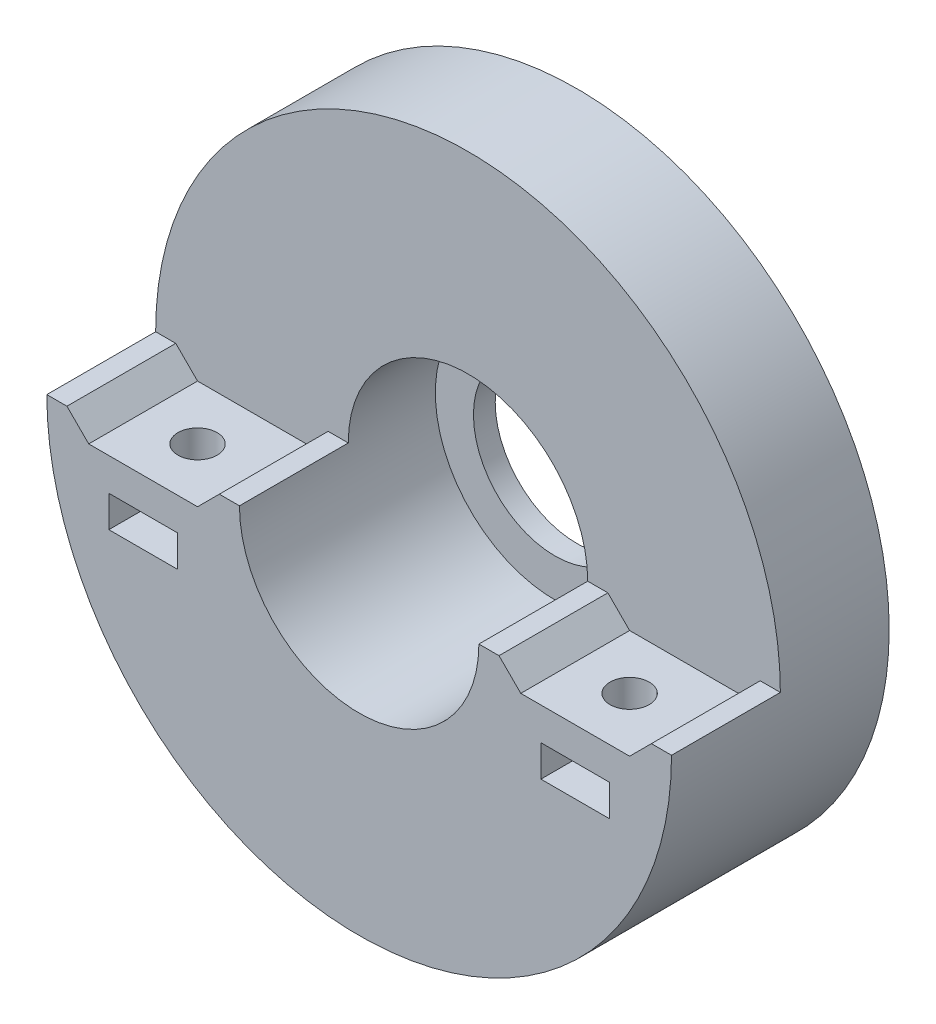
from build123d import *

# Parameters (mm, degrees)
ESBO_O1_R                = 28.7
RESSALTO_EXTRUS_O1_DEPTH = 5
ESBO_O2_R                = 11
CORTE_EXTRUS_O1_DEPTH    = 8
ESBO_O3_R                = 7.5
CORTE_EXTRUS_O2_DEPTH    = 42.801674608
RESSALTO_EXTRUS_O4_START = 10
RESSALTO_EXTRUS_O4_DEPTH = 10
ESBO_O9_W                = 10
ESBO_O9_H                = 2
CORTE_EXTRUS_O5_DEPTH    = 10
CHANFRO1_SIZE            = 2
ESBO_O10_R               = 1.8
CORTE_EXTRUS_O6_DEPTH    = 10
CORTE_EXTRUS_O7_START    = -3
CORTE_EXTRUS_O7_DEPTH    = 2.9


with BuildPart() as part:
    # Esboço1 → Ressalto-extrusão1 (new, symmetric)
    with BuildSketch(Plane.XY):
        Circle(ESBO_O1_R)
    extrude(amount=RESSALTO_EXTRUS_O1_DEPTH, both=True)

    # Esboço2 → Corte-extrusão1 (cut)
    with BuildSketch(Plane.XY.offset(5)):
        Circle(ESBO_O2_R)
    extrude(amount=-CORTE_EXTRUS_O1_DEPTH, mode=Mode.SUBTRACT)

    # Esboço3 → Corte-extrusão2 (cut, through all)
    with BuildSketch(Plane(origin=(0, 0, -5), x_dir=(-1, 0, 0), z_dir=(0, 0, -1))):
        Circle(ESBO_O3_R)
    extrude(amount=-CORTE_EXTRUS_O2_DEPTH, mode=Mode.SUBTRACT)

    # Esboço8 → Ressalto-extrusão4 (add)
    with BuildSketch(Plane.XY.offset(5).offset(RESSALTO_EXTRUS_O4_START)):
        with BuildLine():
            Line((-11, 0), (-28.7, 0))
            ThreePointArc((-28.7, 0), (0, -28.7), (28.7, 0))
            Line((28.7, 0), (11, 0))
            ThreePointArc((11, 0), (0, -11), (-11, 0))
        make_face()
    extrude(amount=-RESSALTO_EXTRUS_O4_DEPTH)

    # Esboço9 → Corte-extrusão5 (cut)
    with BuildSketch(Plane.XY.offset(15)):
        with Locations((-19.85, -1)):
            Rectangle(ESBO_O9_W, ESBO_O9_H)
        with Locations((19.85, -1)):
            Rectangle(ESBO_O9_W, ESBO_O9_H)
    extrude(amount=-CORTE_EXTRUS_O5_DEPTH, mode=Mode.SUBTRACT)

    # Chanfro1
    chanfro1_edges = [part.edges().sort_by_distance(p)[0] for p in [
        (24.85, 0, 10),
        (14.85, 0, 10),
        (-14.85, 0, 10),
        (-24.85, 0, 10),
    ]]
    chamfer(chanfro1_edges, length=CHANFRO1_SIZE - 0.0001)  # a hair under: the kernel refuses the full size

    # Esboço10 → Corte-extrusão6 (cut)
    with BuildSketch(Plane(origin=(0, -2, 0), x_dir=(1, 0, 0), z_dir=(0, 1, 0))):
        with Locations(Location((-19.85, -10, 0), (0, 0, 180))):
            Circle(ESBO_O10_R)
        with Locations((19.85, -10)):
            Circle(ESBO_O10_R)
    extrude(amount=-CORTE_EXTRUS_O6_DEPTH, mode=Mode.SUBTRACT)

    # Esboço11 → Corte-extrusão7 (cut)
    with BuildSketch(Plane(origin=(0, -2, 0), x_dir=(1, 0, 0), z_dir=(0, 1, 0)).offset(CORTE_EXTRUS_O7_START)):
        Polygon((-23, -8.181346652), (-23, -11.818653348), (-23, -15), (-16.7, -15), (-16.7, -11.818653348), (-16.7, -8.181346652), (-19.85, -6.362693304), align=None)
        Polygon((23, -15), (23, -11.818653348), (23, -8.181346652), (19.85, -6.362693304), (16.7, -8.181346652), (16.7, -11.818653348), (16.7, -15), align=None)
    extrude(amount=-CORTE_EXTRUS_O7_DEPTH, mode=Mode.SUBTRACT)


solid = part.part
